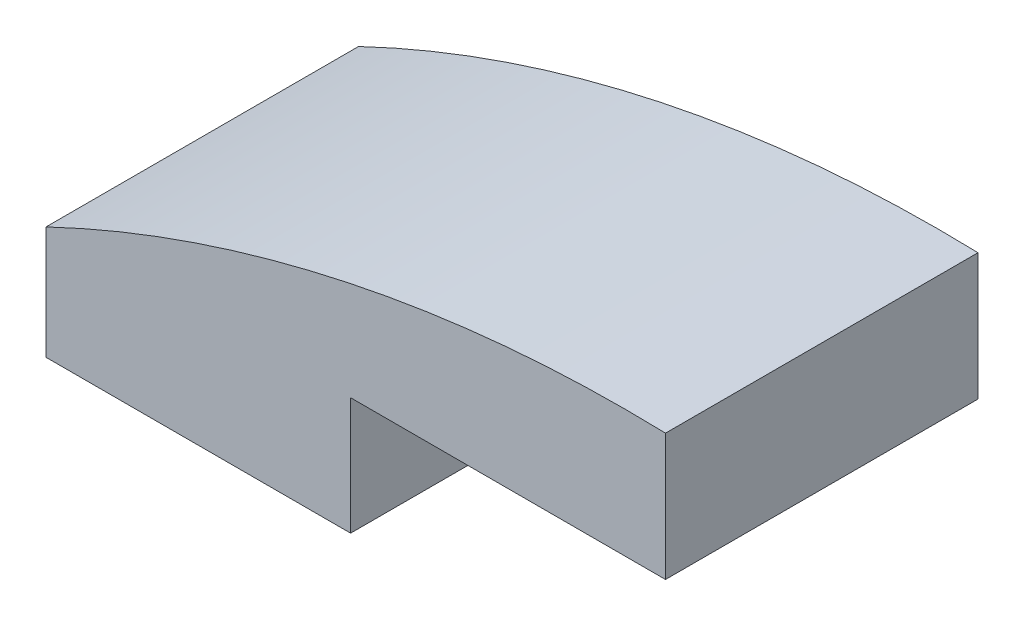
from build123d import *

# Parameters (mm, degrees)
BOSS_EXTRUDE1_DEPTH      = 3.95
SHELL1_START             = -2.75
SHELL1_DEPTH             = 5.5
BOSS_EXTRUDE2_REACH      = 12.601
BOSS_EXTRUDE2_END_RADIUS = 32.700000868
BOSS_EXTRUDE2_START      = 1.2
SKETCH8_R                = 2.3
SKETCH8_R_2              = 2
BOSS_EXTRUDE3_REACH      = 13.983
BOSS_EXTRUDE3_END_RADIUS = 32.700000868
BOSS_EXTRUDE3_START      = 1.2
SKETCH9_R                = 2.25
SKETCH9_R_2              = 2
CUT_EXTRUDE5_DEPTH       = 13.479454835


# Read off the part's stored shape, not the designer's step: Shell1
with BuildPart() as part:
    # Sketch1 → Boss-Extrude1 (new, symmetric)
    with BuildSketch(Plane.XY):
        with BuildLine():
            Line((-7.9, -0.625209461), (-7.9, 2.229657062))
            ThreePointArc((-7.9, 2.229657062), (-0.19997769, 4.839494926), (7.9, 5.540892579))
            Line((7.9, 5.540892579), (7.9, 2.340892579))
            Line((7.9, 2.340892579), (-0.19997769, 2.340892579))
            Line((-0.19997769, 2.340892579), (-0.19997769, -0.625209461))
            Line((-0.19997769, -0.625209461), (-7.9, -0.625209461))
        make_face()
    extrude(amount=BOSS_EXTRUDE1_DEPTH, both=True)

    # Shell1 outline → Shell1 (cut)
    with BuildSketch(Plane.XY.offset(SHELL1_START)):
        with BuildLine():
            Line((-1.39997769, 2.340892579), (6.7, 2.340892579))
            Line((6.7, 2.340892579), (6.7, 4.360243445))
            ThreePointArc((6.7, 4.360243445), (-0.153454716, 3.622525068), (-6.7, 1.464559639))
            Line((-6.7, 1.464559639), (-6.7, -0.625209461))
            Line((-6.7, -0.625209461), (-1.39997769, -0.625209461))
            Line((-1.39997769, -0.625209461), (-1.39997769, 2.340892579))
        make_face()
    extrude(amount=SHELL1_DEPTH, mode=Mode.SUBTRACT)

    # Boss-Extrude2: up to this cylinder (the profile starts inside it)
    boss_extrude2_end = Plane(origin=(6.753451055, -28.339713738, 2.234946), z_dir=(0, 0, -1)) * Cylinder(BOSS_EXTRUDE2_END_RADIUS, 91.602001737, mode=Mode.PRIVATE)
    # Sketch8 → Boss-Extrude2 (add, up to the surface)
    with BuildSketch(Plane(origin=(0, 2.340892579, 0), x_dir=(-1, 0, 0), z_dir=(0, -1, 0)).offset(BOSS_EXTRUDE2_START), mode=Mode.PRIVATE) as boss_extrude2_sk1:
        with Locations(Location((-3.850011155, 0, 0), (0, 0, 90))):
            Circle(SKETCH8_R)
        with Locations(Location((-3.850011155, 0, 0), (0, 0, 90))):
            Circle(SKETCH8_R_2, mode=Mode.SUBTRACT)
    boss_extrude2_tool1 = extrude(boss_extrude2_sk1.sketch, amount=-BOSS_EXTRUDE2_REACH, mode=Mode.PRIVATE) & boss_extrude2_end
    add(boss_extrude2_tool1.solids().sort_by_distance((3.850011, 1.140893, 2.234946))[0])

    # Boss-Extrude3: up to this cylinder (the profile starts inside it)
    boss_extrude3_end = Plane(origin=(6.753451055, -28.339713738, 2.18636), z_dir=(0, 0, -1)) * Cylinder(BOSS_EXTRUDE3_END_RADIUS, 94.366001737, mode=Mode.PRIVATE)
    # Sketch9 → Boss-Extrude3 (add, up to the surface)
    with BuildSketch(Plane(origin=(0, -0.625209461, 0), x_dir=(-1, 0, 0), z_dir=(0, -1, 0)).offset(BOSS_EXTRUDE3_START), mode=Mode.PRIVATE) as boss_extrude3_sk1:
        with Locations(Location((4.049988845, 0, 0), (0, 0, 90))):
            Circle(SKETCH9_R)
        with Locations(Location((4.049988845, 0, 0), (0, 0, 90))):
            Circle(SKETCH9_R_2, mode=Mode.SUBTRACT)
    boss_extrude3_tool1 = extrude(boss_extrude3_sk1.sketch, amount=-BOSS_EXTRUDE3_REACH, mode=Mode.PRIVATE) & boss_extrude3_end
    add(boss_extrude3_tool1.solids().sort_by_distance((-4.049989, -1.825209, 2.18636))[0])

    # Sketch10 → Cut-Extrude5 (cut, through all)
    with BuildSketch(Plane(origin=(0, 0, -3.95), x_dir=(-1, 0, 0), z_dir=(0, 0, -1))):
        Polygon((-7.9, 2.340892579), (-7.760644151, 2.340892579), (-7.760644151, 5.545321616), (-7.9, 5.540892579), align=None)
    extrude(amount=-CUT_EXTRUDE5_DEPTH, mode=Mode.SUBTRACT)


with BuildPart() as cut_extrude5_kept_piece:
    # of the separate pieces the step leaves, the one the design keeps (cut_extrude5_pieces_kept)
    add(part.part.solids().sort_by_distance((-7.9, -0.625209461, -3.95))[0])


solid = cut_extrude5_kept_piece.part
